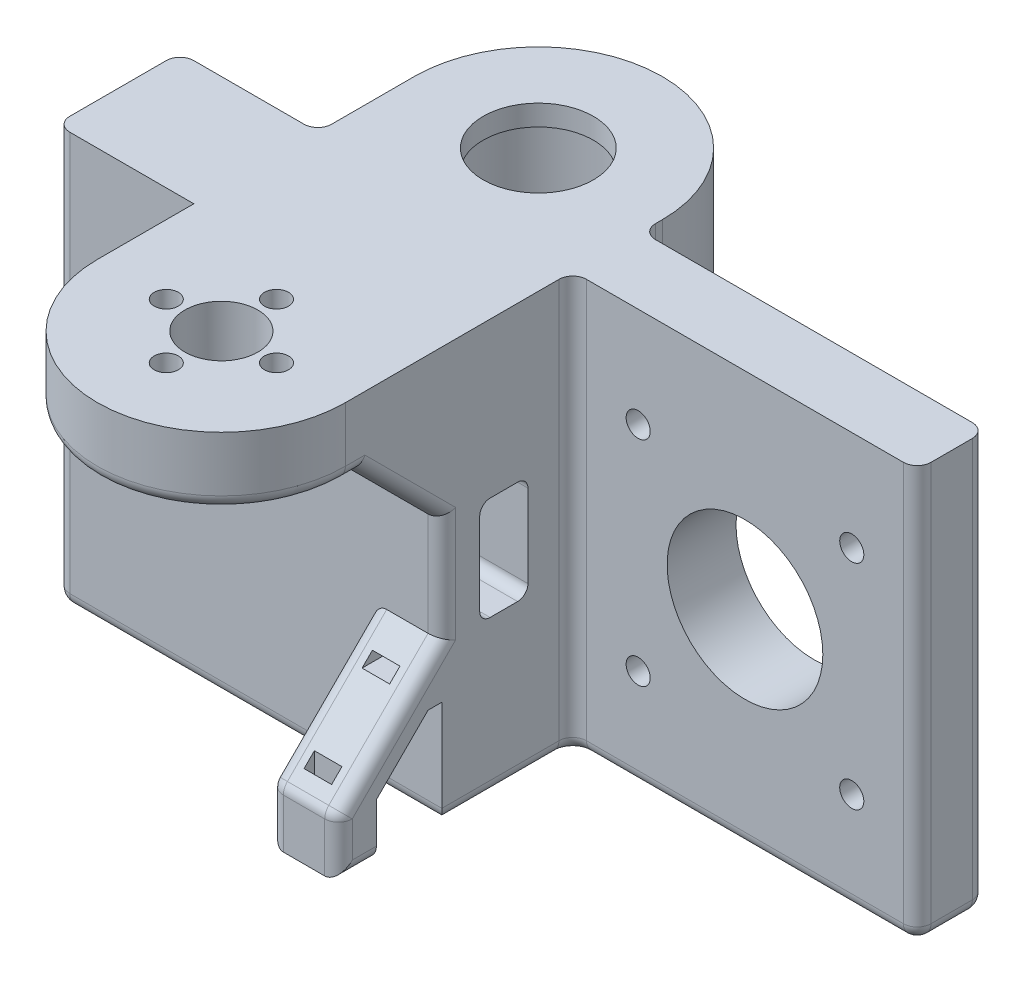
from build123d import *
from build123d.topology import SkipClean

# Parameters (mm, degrees)
SKETCH1_W           = 36
SKETCH1_H           = 75
SKETCH1_R           = 10.65
SKETCH1_R_2         = 5.3
BOSS_EXTRUDE1_DEPTH = 60
SKETCH2_R           = 1.75
CUT_EXTRUDE1_DEPTH  = 7
SKETCH4_W           = 18
SKETCH4_H           = 60
BOSS_EXTRUDE2_DEPTH = 20
SKETCH5_R           = 4.15
CUT_EXTRUDE2_DEPTH  = 30
CUT_EXTRUDE3_DEPTH  = 112.180034179
SKETCH7_W           = 50
SKETCH7_H           = 10
BOSS_EXTRUDE3_DEPTH = 60
CUT_EXTRUDE4_REACH  = 116.11
SKETCH8_R           = 11.3
SKETCH8_R_2         = 1.75
SKETCH9_W           = 36
SKETCH9_H           = 26
CUT_EXTRUDE5_DEPTH  = 50
CUT_EXTRUDE6_DEPTH  = 60
BOSS_EXTRUDE6_DEPTH = 60
BOSS_EXTRUDE7_START = -3
SKETCH21_R          = 10.65
SKETCH21_R_2        = 8
BOSS_EXTRUDE7_DEPTH = 3
CUT_EXTRUDE7_DEPTH  = 10
BOSS_EXTRUDE5_DEPTH = 10
BOSS_EXTRUDE8_DEPTH = 10
CUT_EXTRUDE8_REACH  = 131.507
SKETCH24_W          = 4
SKETCH24_H          = 1.5
CUT_EXTRUDE9_REACH  = 113.857
CUT_SWEEP1_START    = 29
CUT_SWEEP1_DEPTH    = 4
CHAMFER2_SIZE       = 12
FILLET1_R           = 2


with BuildPart() as part:
    # Sketch1 → Boss-Extrude1 (new body)
    with BuildSketch(Plane(origin=(0, 0, 0), x_dir=(1, 0, 0), z_dir=(0, 1, 0))):
        with Locations((18, 37.5)):
            Rectangle(SKETCH1_W, SKETCH1_H)
        with Locations(Location((18, 58, 0), (0, 0, 90))):
            Circle(SKETCH1_R, mode=Mode.SUBTRACT)
        with Locations(Location((18, 12, 0), (0, 0, 90))):
            Circle(SKETCH1_R_2, mode=Mode.SUBTRACT)
    extrude(amount=BOSS_EXTRUDE1_DEPTH)

    # Sketch2 → Cut-Extrude1 (cut)
    with BuildSketch(Plane.XZ.offset(-60)):
        with Locations(Location((10, -12, 0), (0, 0, 270))):
            Circle(SKETCH2_R)
        with Locations(Location((26, -12, 0), (0, 0, 90))):
            Circle(SKETCH2_R)
        with Locations(Location((18, -4, 0), (0, 0, 270))):
            Circle(SKETCH2_R)
        with Locations(Location((18, -20, 0), (0, 0, 90))):
            Circle(SKETCH2_R)
    extrude(amount=CUT_EXTRUDE1_DEPTH, mode=Mode.SUBTRACT)

    # Sketch4 → Boss-Extrude2 (add)
    with BuildSketch(Plane.ZY):
        with Locations((-35, 30)):
            Rectangle(SKETCH4_W, SKETCH4_H)
    extrude(amount=BOSS_EXTRUDE2_DEPTH)

    # Sketch5 → Cut-Extrude2 (cut)
    with BuildSketch(Plane.ZY.offset(20)):
        with Locations((-35, 47.5)):
            Circle(SKETCH5_R)
        with Locations(Location((-35, 12.5, 0), (0, 0, 180))):
            Circle(SKETCH5_R)
    extrude(amount=-CUT_EXTRUDE2_DEPTH, mode=Mode.SUBTRACT)

    # Sketch6 → Cut-Extrude3 (cut, through all)
    with BuildSketch(Plane.ZY.offset(20)):
        with BuildLine():
            Line((-37, 37.5), (-33, 37.5))
            ThreePointArc((-33, 37.5), (-31.939339828, 37.060660172), (-31.5, 36))
            Line((-31.5, 36), (-31.5, 24))
            ThreePointArc((-31.5, 24), (-31.939339828, 22.939339828), (-33, 22.5))
            Line((-33, 22.5), (-37, 22.5))
            ThreePointArc((-37, 22.5), (-38.060660172, 22.939339828), (-38.5, 24))
            Line((-38.5, 24), (-38.5, 36))
            ThreePointArc((-38.5, 36), (-38.060660172, 37.060660172), (-37, 37.5))
        make_face()
    extrude(amount=-CUT_EXTRUDE3_DEPTH, mode=Mode.SUBTRACT)

    # Sketch7 → Boss-Extrude3 (add)
    with BuildSketch(Plane.XZ):
        with Locations((61, -50)):
            Rectangle(SKETCH7_W, SKETCH7_H)
    extrude(amount=-BOSS_EXTRUDE3_DEPTH)

    # Sketch8 → Cut-Extrude4 (cut, up to next)
    with BuildSketch(Plane.XY.offset(-45), mode=Mode.PRIVATE) as cut_extrude4_sk1:
        with Locations((61, 30)):
            Circle(SKETCH8_R)
    cut_extrude4_tool1 = extrude(cut_extrude4_sk1.sketch, amount=-CUT_EXTRUDE4_REACH, mode=Mode.PRIVATE) & part.part
    # Sketch8 → Cut-Extrude4 (cut, up to next)
    with BuildSketch(Plane.XY.offset(-45), mode=Mode.PRIVATE) as cut_extrude4_sk2:
        with Locations((45.5, 45.5)):
            Circle(SKETCH8_R_2)
    cut_extrude4_tool2 = extrude(cut_extrude4_sk2.sketch, amount=-CUT_EXTRUDE4_REACH, mode=Mode.PRIVATE) & part.part
    # Sketch8 → Cut-Extrude4 (cut, up to next)
    with BuildSketch(Plane.XY.offset(-45), mode=Mode.PRIVATE) as cut_extrude4_sk3:
        with Locations(Location((76.5, 45.5, 0), (0, 0, 180))):
            Circle(SKETCH8_R_2)
    cut_extrude4_tool3 = extrude(cut_extrude4_sk3.sketch, amount=-CUT_EXTRUDE4_REACH, mode=Mode.PRIVATE) & part.part
    # Sketch8 → Cut-Extrude4 (cut, up to next)
    with BuildSketch(Plane.XY.offset(-45), mode=Mode.PRIVATE) as cut_extrude4_sk4:
        with Locations((76.5, 14.5)):
            Circle(SKETCH8_R_2)
    cut_extrude4_tool4 = extrude(cut_extrude4_sk4.sketch, amount=-CUT_EXTRUDE4_REACH, mode=Mode.PRIVATE) & part.part
    # Sketch8 → Cut-Extrude4 (cut, up to next)
    with BuildSketch(Plane.XY.offset(-45), mode=Mode.PRIVATE) as cut_extrude4_sk5:
        with Locations(Location((45.5, 14.5, 0), (0, 0, 180))):
            Circle(SKETCH8_R_2)
    cut_extrude4_tool5 = extrude(cut_extrude4_sk5.sketch, amount=-CUT_EXTRUDE4_REACH, mode=Mode.PRIVATE) & part.part
    add(cut_extrude4_tool1.solids().sort_by_distance((61, 30, -45))[0], mode=Mode.SUBTRACT)
    add(cut_extrude4_tool2.solids().sort_by_distance((45.5, 45.5, -45))[0], mode=Mode.SUBTRACT)
    add(cut_extrude4_tool3.solids().sort_by_distance((76.5, 45.5, -45))[0], mode=Mode.SUBTRACT)
    add(cut_extrude4_tool4.solids().sort_by_distance((76.5, 14.5, -45))[0], mode=Mode.SUBTRACT)
    add(cut_extrude4_tool5.solids().sort_by_distance((45.5, 14.5, -45))[0], mode=Mode.SUBTRACT)

    # Sketch9 → Cut-Extrude5 (cut)
    with BuildSketch(Plane.XZ):
        with Locations((18, -13)):
            Rectangle(SKETCH9_W, SKETCH9_H)
    extrude(amount=-CUT_EXTRUDE5_DEPTH, mode=Mode.SUBTRACT)

    # Sketch10 → Cut-Extrude6 (cut)
    with BuildSketch(Plane.XZ):
        with BuildLine():
            Line((12.083920217, -75), (0, -75))
            Line((0, -75), (0, -58))
            ThreePointArc((0, -58), (3.328779258, -68.428580054), (12.083920217, -75))
        make_face()
        with BuildLine():
            Line((23.916079783, -75), (36, -75))
            Line((36, -75), (36, -58))
            ThreePointArc((36, -58), (32.671220742, -68.428580054), (23.916079783, -75))
        make_face()
    extrude(amount=-CUT_EXTRUDE6_DEPTH, mode=Mode.SUBTRACT)

    # Sketch19 → Boss-Extrude6 (add)
    with BuildSketch(Plane.XZ):
        with BuildLine():
            Line((12.083920217, -75), (23.916079783, -75))
            ThreePointArc((23.916079783, -75), (18, -76), (12.083920217, -75))
        make_face()
    extrude(amount=-BOSS_EXTRUDE6_DEPTH)

    # Sketch21 → Boss-Extrude7 (add)
    with BuildSketch(Plane(origin=(0, 60, 0), x_dir=(1, 0, 0), z_dir=(0, 1, 0)).offset(BOSS_EXTRUDE7_START)):
        with Locations(Location((18, 58, 0), (0, 0, 90))):
            Circle(SKETCH21_R)
        with Locations(Location((18, 58, 0), (0, 0, 270))):
            Circle(SKETCH21_R_2, mode=Mode.SUBTRACT)
    extrude(amount=BOSS_EXTRUDE7_DEPTH)

    # Sketch11 → Cut-Extrude7 (cut)
    with BuildSketch(Plane(origin=(0, 60, 0), x_dir=(1, 0, 0), z_dir=(0, 1, 0))):
        with BuildLine():
            Line((0, 12), (0, 0))
            Line((0, 0), (4.583592135, 0))
            ThreePointArc((4.583592135, 0), (1.184897539, 5.577202384), (0, 12))
        make_face()
        with BuildLine():
            Line((36, 12), (36, 0))
            Line((36, 0), (31.416407865, 0))
            ThreePointArc((31.416407865, 0), (34.815102461, 5.577202384), (36, 12))
        make_face()
    extrude(amount=-CUT_EXTRUDE7_DEPTH, mode=Mode.SUBTRACT)

    # Sketch13 → Boss-Extrude5 (add)
    with SkipClean():  # the faces are left unmerged after this step: merging them gives an invalid solid
        with BuildSketch(Plane(origin=(0, 60, 0), x_dir=(1, 0, 0), z_dir=(0, 1, 0))):
            with BuildLine():
                Line((4.583592135, 0), (31.416407865, 0))
                ThreePointArc((31.416407865, 0), (18, -6), (4.583592135, 0))
            make_face()
        extrude(amount=-BOSS_EXTRUDE5_DEPTH)

    # Sketch23 → Boss-Extrude8 (add)
    with BuildSketch(Plane(origin=(36, 0, 0), x_dir=(0, 0, -1), z_dir=(1, 0, 0))):
        Polygon((26, 23), (11, 8), (11, 0), (26, 0), align=None)
    extrude(amount=-BOSS_EXTRUDE8_DEPTH)

    # Cut-Extrude8: up to this plane
    cut_extrude8_end = Plane(origin=(26, 23, -26), z_dir=(0, 0.7071067811865437, 0.7071067811865515))
    # Sketch24 → Cut-Extrude8 (cut, up to the surface)
    with BuildSketch(Plane.XZ, mode=Mode.PRIVATE) as cut_extrude8_sk1:
        with Locations((31, -13.75)):
            Rectangle(SKETCH24_W, SKETCH24_H)
    cut_extrude8_tool1 = split(extrude(cut_extrude8_sk1.sketch, amount=-CUT_EXTRUDE8_REACH, mode=Mode.PRIVATE), bisect_by=cut_extrude8_end, keep=Keep.BOTH, mode=Mode.PRIVATE)
    add(cut_extrude8_tool1.solids().sort_by_distance((31, 0, -13.75))[0], mode=Mode.SUBTRACT)

    # Sketch25 → Cut-Extrude9 (cut, up to next)
    with BuildSketch(Plane(origin=(36, 0, 0), x_dir=(0, 0, -1), z_dir=(1, 0, 0)), mode=Mode.PRIVATE) as cut_extrude9_sk1:
        Polygon((16.5, 0), (26, 0), (26, 15.343145751), (24, 15.343145751), (16.5, 7.843145751), align=None)
    cut_extrude9_tool1 = extrude(cut_extrude9_sk1.sketch, amount=-CUT_EXTRUDE9_REACH, mode=Mode.PRIVATE) & part.part
    add(cut_extrude9_tool1.solids().sort_by_distance((36, 6.435116, -21.787946))[0], mode=Mode.SUBTRACT)

    # Cut-Sweep1: read off the stored shape, not the designer's step
    # Cut-Sweep1 outline → Cut-Sweep1 (cut)
    with BuildSketch(Plane.YZ.offset(CUT_SWEEP1_START)):
        with BuildLine():
            Line((19.921572875, -22.921572875), (18.421572875, -21.421572875))
            add(Edge.make_bspline(
                [(18.421572875, -21.421572875), (18.421572875, -21.938326003), (18.421572875, -22.455079131), (18.421572875, -23.476526882), (18.421572875, -23.981221506), (18.421572875, -24.738263441), (18.421572875, -24.990610753), (18.421572875, -25.369131721), (18.421572875, -25.495305376), (18.421572875, -25.747652688), (18.421581217, -25.891031974), (18.421566925, -26.077721599), (18.418359294, -26.130852526), (18.405542514, -26.26104187), (18.39593825, -26.325827803), (18.357654737, -26.518378806), (18.319464396, -26.64433641), (18.169067029, -27.007427774), (18.020906029, -27.229093971), (17.650666846, -27.599333154), (17.429000649, -27.747494154), (17.065909286, -27.897891521), (16.939951681, -27.936081862), (16.747400678, -27.974365375), (16.682614745, -27.983969638), (16.552425401, -27.996786418), (16.499294475, -27.99999405), (16.347706988, -28.000005655), (16.250514824, -28), (16.079456774, -28), (15.993927748, -28), (15.737340672, -28), (15.566282621, -28), (15.053108469, -28), (14.710992367, -28), (13.684644063, -28), (13.00041186, -28), (10.94771525, -28), (9.579250844, -28), (5.473857625, -28), (2.736928813, -28), (0, -28)],
                knots=[0.04798778, 0.04798778, 0.04798778, 0.04798778, 0.098324802, 0.098324802, 0.147487203, 0.147487203, 0.172068403, 0.172068403, 0.184359003, 0.184359003, 0.196649603, 0.196649603, 0.205415891, 0.205415891, 0.21418218, 0.21418218, 0.231714756, 0.231714756, 0.266779908, 0.266779908, 0.30184506, 0.30184506, 0.319377637, 0.319377637, 0.328143925, 0.328143925, 0.336910213, 0.336910213, 0.345241612, 0.345241612, 0.353573011, 0.353573011, 0.370235808, 0.370235808, 0.403561404, 0.403561404, 0.470212595, 0.470212595, 0.603514977, 0.603514977, 0.870119742, 0.870119742, 0.870119742, 0.870119742], degree=3))
            Line((0, -28), (0, -29.5))
            add(Edge.make_bspline(
                [(19.921572875, -22.921572875), (19.921572875, -22.938326003), (19.921572875, -22.955079131), (19.921572875, -23.476526882), (19.921572875, -23.981221506), (19.921572875, -24.738263441), (19.921572875, -24.990610753), (19.921572875, -25.369131721), (19.921572875, -25.495305376), (19.921572875, -25.747652688), (19.921587474, -25.856621076), (19.921562463, -26.102265222), (19.915949107, -26.22899192), (19.893519742, -26.456823273), (19.876712281, -26.570198655), (19.809716134, -26.90716291), (19.742883037, -27.127588718), (19.479687644, -27.762998604), (19.220405895, -28.150914449), (18.572487324, -28.798833019), (18.184571479, -29.058114769), (17.549161593, -29.321310161), (17.328735785, -29.388143258), (16.99177153, -29.455139406), (16.878396148, -29.471946867), (16.650564796, -29.494376232), (16.523838097, -29.499989588), (16.324380957, -29.500009896), (16.250514824, -29.5), (16.079456774, -29.5), (15.993927748, -29.5), (15.737340672, -29.5), (15.566282621, -29.5), (15.053108469, -29.5), (14.710992367, -29.5), (13.684644063, -29.5), (13.00041186, -29.5), (10.94771525, -29.5), (9.579250844, -29.5), (5.473857625, -29.5), (2.736928813, -29.5), (0, -29.5)],
                knots=[0.096692876, 0.096692876, 0.096692876, 0.096692876, 0.098324802, 0.098324802, 0.147487203, 0.147487203, 0.172068403, 0.172068403, 0.184359003, 0.184359003, 0.196649603, 0.196649603, 0.205415891, 0.205415891, 0.21418218, 0.21418218, 0.231714756, 0.231714756, 0.266779908, 0.266779908, 0.30184506, 0.30184506, 0.319377637, 0.319377637, 0.328143925, 0.328143925, 0.336910213, 0.336910213, 0.345241612, 0.345241612, 0.353573011, 0.353573011, 0.370235808, 0.370235808, 0.403561404, 0.403561404, 0.470212595, 0.470212595, 0.603514977, 0.603514977, 0.870119742, 0.870119742, 0.870119742, 0.870119742], degree=3))
        make_face()
    extrude(amount=CUT_SWEEP1_DEPTH, mode=Mode.SUBTRACT)

    # Chamfer2
    # the kernel refuses this chamfer: 12 mm, written as the material it adds along each edge
    with BuildSketch(Plane(origin=(0, 50, -26), x_dir=(0, -1, 0), z_dir=(1, 0, 0))) as chamfer2_piece_1_section:
        Polygon((CHAMFER2_SIZE, 0), (0, -CHAMFER2_SIZE), (0, 0), align=None)
    chamfer2_piece_1 = extrude(amount=36, mode=Mode.PRIVATE)
    chamfer2_piece_1 = chamfer2_piece_1 - Plane(origin=(18, 50, -12), x_dir=(0, 0, -1), z_dir=(0, -1, 0)) * Cylinder(5.3, 120, mode=Mode.PRIVATE)
    add(chamfer2_piece_1)

    # Fillet1
    fillet1_edges = [part.edges().sort_by_distance(p)[0] for p in [
        (0, 44, -20),
        (36, 44, -20),
        (34.815102461, 50, -5.577202384),
        (36, 50, -13),
        (0, 50, -13),
        (1.184897539, 50, -5.577202384),
        (18, 50, 6),
        (36, 30.5, -26),
        (8, 0, -26),
        (-20, 30, -26),
        (36, 0, -35.5),
        (36, 0, -13.75),
        (36, 4, -11),
        (36, 15.5, -18.5),
        (36, 30, -45),
        (26, 15.5, -18.5),
        (31, 8, -11),
        (26, 0, -13.75),
        (26, 4, -11),
        (61, 0, -45),
        (86, 0, -50),
        (61, 0, -55),
        (-20, 0, -35),
        (-10, 0, -44),
        (18, 0, -76),
        (0, 0, -51),
        (-20, 30, -44),
        (86, 30, -45),
        (86, 30, -55),
        (36, 30, -55),
        (0, 30, -44),
    ]]
    fillet(fillet1_edges, radius=FILLET1_R - 0.0001)  # a hair under: the kernel refuses the full size


solid = part.part
